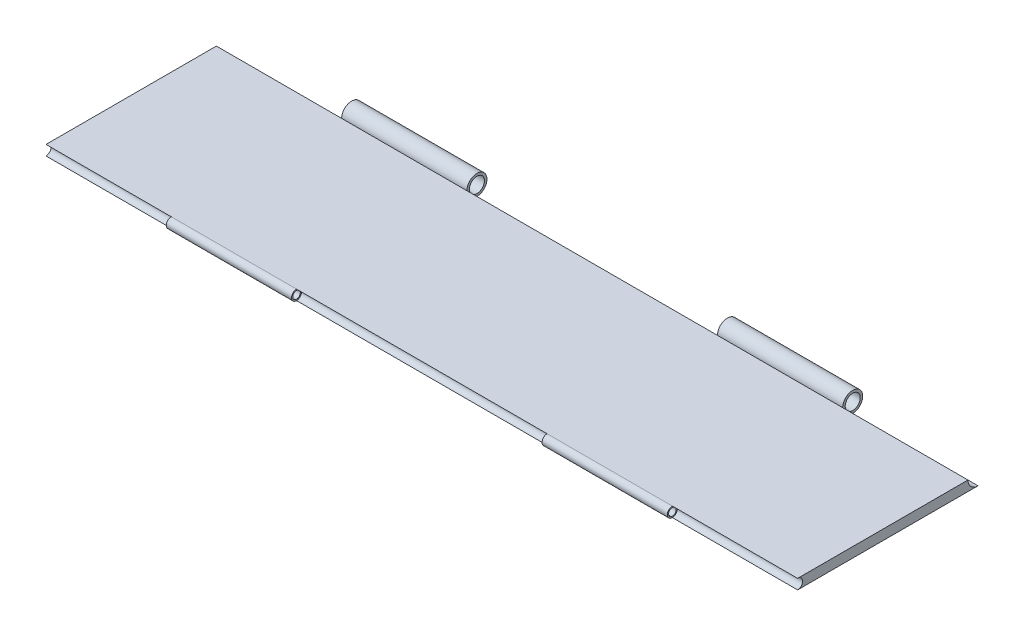
from build123d import *

# Parameters (mm, degrees)
SKETCH_1_W                   = 300
SKETCH_1_H                   = 72
EXTRUDE_1_DEPTH              = 4
SKETCH_2_R                   = 4
CUT_EXTRUDE_1_DEPTH          = 300
SKETCH_3_R                   = 4
SKETCH_3_R_2                 = 3
EXTRUDE_1_2_DEPTH            = 300
SPLIT_START                  = -51.97740113
SPLIT_BODIES_1_OUTLINE_R     = 4
SPLIT_BODIES_1_OUTLINE_R_2   = 3
SPLIT_BODIES_1_DEPTH         = 100
SPLIT_START_2                = -151.97740113
SPLIT_BODIES_1_2_OUTLINE_R   = 4
SPLIT_BODIES_1_2_OUTLINE_R_2 = 3
SPLIT_BODIES_1_2_DEPTH       = 50
SPLIT_START_3                = 98.02259887
SPLIT_BODIES_1_3_OUTLINE_R   = 4
SPLIT_BODIES_1_3_OUTLINE_R_2 = 3
SPLIT_BODIES_1_3_DEPTH       = 50
SKETCH_7_R                   = 2
CUT_EXTRUDE_2_DEPTH          = 309.175133319
EXTRUDE_START                = 50
SKETCH_8_R                   = 2
SKETCH_8_R_2                 = 1.5
EXTRUDE_3_DEPTH              = 50
SKETCH_10_R                  = 2
SKETCH_10_R_2                = 1.5
EXTRUDE_4_DEPTH              = 50


# Read off the part's stored shape, not the designer's step: 分割1
with BuildPart() as part:
    # 草图1 → Extrude 1 (new body)
    with BuildSketch(Plane(origin=(0, 0, 0), x_dir=(1, 0, 0), z_dir=(0, 1, 0))):
        with Locations((-1.97740113, -34.056497175)):
            Rectangle(SKETCH_1_W, SKETCH_1_H)
    extrude(amount=EXTRUDE_1_DEPTH)

    # 草图2 → 切除-拉伸1 (cut)
    with BuildSketch(Plane(origin=(148.02259887, 0, 0), x_dir=(0, 0, -1), z_dir=(1, 0, 0))):
        with Locations((1.943502825, 4)):
            Circle(SKETCH_2_R)
    extrude(amount=-CUT_EXTRUDE_1_DEPTH, mode=Mode.SUBTRACT)

    # 草图7 → 切除-拉伸2 (cut, through all)
    with BuildSketch(Plane(origin=(148.02259887, 0, 0), x_dir=(0, 0, -1), z_dir=(1, 0, 0))):
        with Locations((-70.056497175, 2)):
            Circle(SKETCH_7_R)
    extrude(amount=-CUT_EXTRUDE_2_DEPTH, mode=Mode.SUBTRACT)

    # 草图8 → 拉伸-薄壁3 (add)
    with BuildSketch(Plane(origin=(-101.97740113, 0, 0), x_dir=(0, 0, -1), z_dir=(1, 0, 0)).offset(EXTRUDE_START)):
        with Locations((-70.056497175, 2)):
            Circle(SKETCH_8_R)
        with Locations((-70.056497175, 2)):
            Circle(SKETCH_8_R_2, mode=Mode.SUBTRACT)
    extrude(amount=-EXTRUDE_3_DEPTH)

    # 草图10 → 拉伸-薄壁4 (add)
    with BuildSketch(Plane(origin=(98.02259887, 0, 0), x_dir=(0, 0, -1), z_dir=(1, 0, 0))):
        with Locations((-70.056497175, 2)):
            Circle(SKETCH_10_R)
        with Locations((-70.056497175, 2)):
            Circle(SKETCH_10_R_2, mode=Mode.SUBTRACT)
    extrude(amount=-EXTRUDE_4_DEPTH)


with BuildPart() as body_2:
    # 草图3 → Extrude 1 2 (new body)
    with BuildSketch(Plane(origin=(148.02259887, 0, 0), x_dir=(0, 0, -1), z_dir=(1, 0, 0))):
        with Locations((1.943502825, 4)):
            Circle(SKETCH_3_R)
        with Locations((1.943502825, 4)):
            Circle(SKETCH_3_R_2, mode=Mode.SUBTRACT)
    extrude(amount=-EXTRUDE_1_2_DEPTH)

    # Split Bodies 1 outline → Split Bodies 1 (cut)
    with BuildSketch(Plane.YZ.offset(SPLIT_START)):
        with Locations((4, -1.943502825)):
            Circle(SPLIT_BODIES_1_OUTLINE_R)
        with Locations((4, -1.943502825)):
            Circle(SPLIT_BODIES_1_OUTLINE_R_2, mode=Mode.SUBTRACT)
    extrude(amount=SPLIT_BODIES_1_DEPTH, mode=Mode.SUBTRACT)

    # Split Bodies 1 2 outline → Split Bodies 1 2 (cut)
    with BuildSketch(Plane.YZ.offset(SPLIT_START_2)):
        with Locations((4, -1.943502825)):
            Circle(SPLIT_BODIES_1_2_OUTLINE_R)
        with Locations((4, -1.943502825)):
            Circle(SPLIT_BODIES_1_2_OUTLINE_R_2, mode=Mode.SUBTRACT)
    extrude(amount=SPLIT_BODIES_1_2_DEPTH, mode=Mode.SUBTRACT)

    # Split Bodies 1 3 outline → Split Bodies 1 3 (cut)
    with BuildSketch(Plane.YZ.offset(SPLIT_START_3)):
        with Locations((4, -1.943502825)):
            Circle(SPLIT_BODIES_1_3_OUTLINE_R)
        with Locations((4, -1.943502825)):
            Circle(SPLIT_BODIES_1_3_OUTLINE_R_2, mode=Mode.SUBTRACT)
    extrude(amount=SPLIT_BODIES_1_3_DEPTH, mode=Mode.SUBTRACT)


solid = Compound([part.part, body_2.part])
